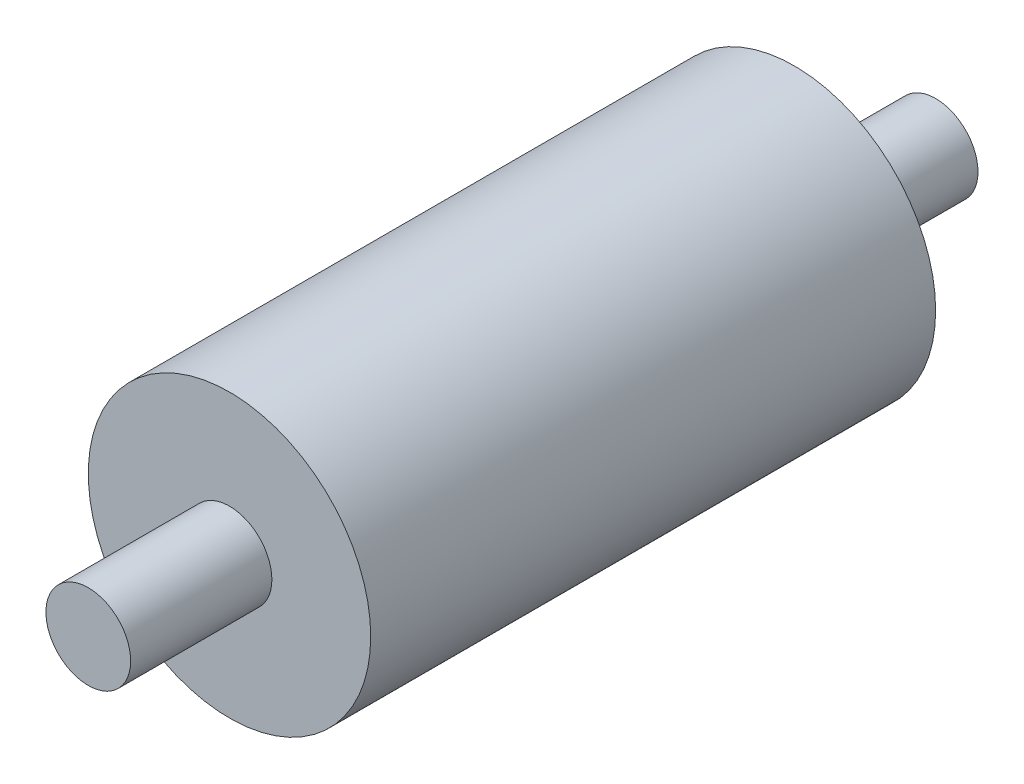
from build123d import *

# Parameters (mm, degrees)
BOSS_EXTRUDE1_DEPTH      = 20
BOSS_EXTRUDE1_DEPTH_BACK = 20
SKETCH1_R                = 10
SKETCH2_R                = 3
BOSS_EXTRUDE2_DEPTH      = 10


with BuildPart() as part:
    # Sketch1 → Boss-Extrude1 (new, two sides: drawn at the far end of the back side and taken through both)
    with BuildSketch(Plane.XY.offset(-BOSS_EXTRUDE1_DEPTH_BACK)):
        Circle(SKETCH1_R)
    extrude(amount=BOSS_EXTRUDE1_DEPTH + BOSS_EXTRUDE1_DEPTH_BACK)

    # Sketch2 → Boss-Extrude2 (add)
    with BuildSketch(Plane.XY.offset(20)):
        Circle(SKETCH2_R)
    boss_extrude2 = extrude(amount=BOSS_EXTRUDE2_DEPTH)

    # Mirror1: Boss-Extrude2 across plane
    add(boss_extrude2.mirror(Plane.XY))


solid = part.part
